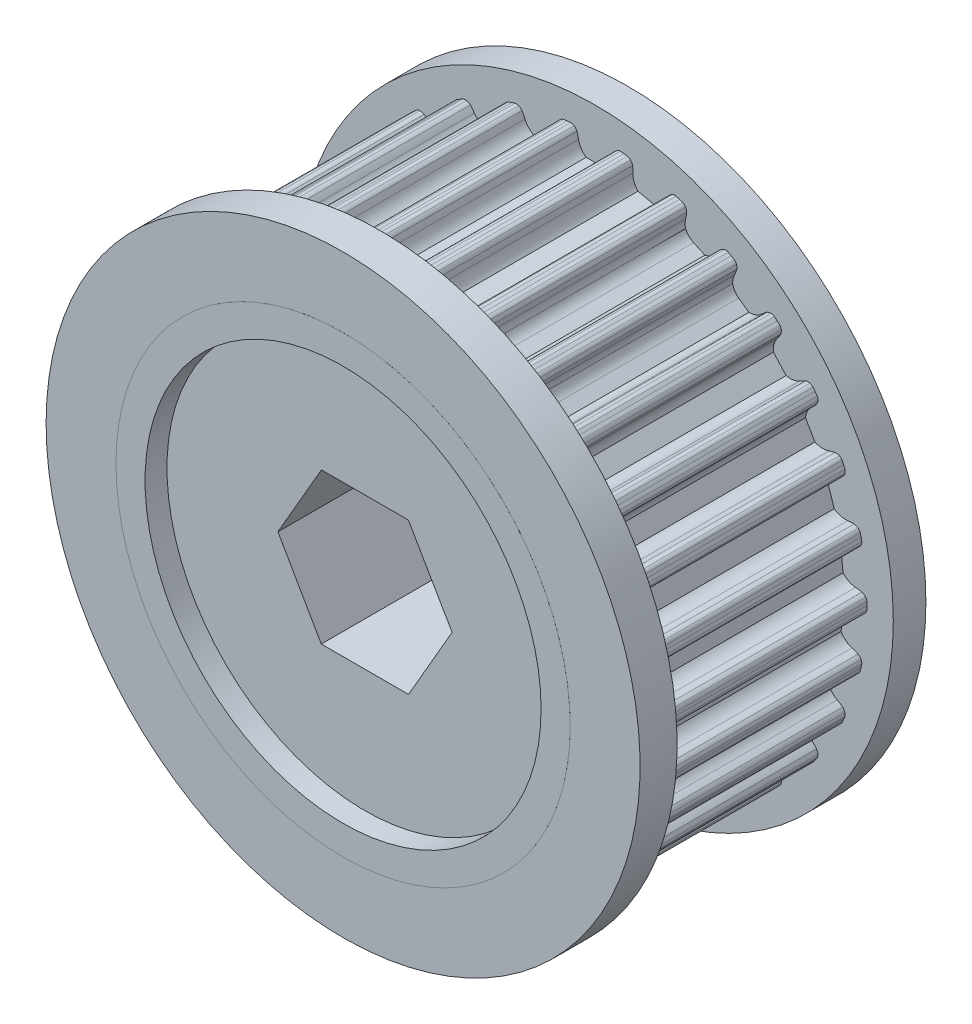
from build123d import *

# Parameters (mm, degrees)
BOSS_EXTRUDE1_DEPTH    = 18.5
CUT_EXTRUDE2_START     = -1.5875
CUT_EXTRUDE2_OUTLINE_R = 19.5
CUT_EXTRUDE2_DEPTH     = 1.5875
HOLE1_D                = 34
HOLE1_DEPTH            = 9.5
SKETCH10_R             = 17.178376729
BOSS_EXTRUDE3_DEPTH    = 9.5
BOSS_EXTRUDE4_START    = 0.00254
SKETCH11_R             = 19.5
BOSS_EXTRUDE4_DEPTH    = 0.00254
HOLE2_D                = 34
HOLE2_DEPTH            = 9.5
SKETCH14_R             = 17.134108578
BOSS_EXTRUDE5_DEPTH    = 7.62
CUT_EXTRUDE1_DEPTH     = 44.659262742
FILLET1_R              = 1.313177717


# Read off the part's stored shape, not the designer's step: Cut-Extrude2
with BuildPart() as part:
    # Sketch1 → Revolve1 (revolve)
    with BuildSketch(Plane(origin=(0, 0, 0), x_dir=(1, 0, 0), z_dir=(0, 1, 0))):
        Polygon((23.331731391, 12.05), (0, 12.05), (0, 9.25), (23.3, 9.25), (25.563462781, 9.25), (25.563462781, 12.05), align=None)
    revolve(axis=Axis((0, 0, -11), (0, 0, 1)))

    # Sketch2 → Boss-Extrude1 (add)
    with BuildSketch(Plane.XY.offset(-9.25)):
        with BuildLine():
            Line((-22.220966527, 5.532138415), (-22.198501446, 5.535521924))
            ThreePointArc((-22.198501446, 5.535521924), (-21.926261017, 5.525385682), (-21.655224303, 5.49787761))
            ThreePointArc((-21.655224303, 5.49787761), (-21.042755416, 5.541395644), (-20.489166215, 5.807009938))
            Line((-20.489166215, 5.807009938), (-19.98935847, 7.345260006))
            ThreePointArc((-19.98935847, 7.345260006), (-20.281097376, 7.885538053), (-20.751015856, 8.280745061))
            ThreePointArc((-20.751015856, 8.280745061), (-20.986458003, 8.417801947), (-21.21266307, 8.569620464))
            Line((-21.21266307, 8.569620464), (-21.228848926, 8.585562424))
            ThreePointArc((-21.228848926, 8.585562424), (-21.338210088, 8.728762181), (-21.418316561, 8.890159169))
            ThreePointArc((-21.418316561, 8.890159169), (-21.437347286, 9.04701588), (-21.410246912, 9.202681439))
            ThreePointArc((-21.410246912, 9.202681439), (-21.351945296, 9.341601113), (-21.288640136, 9.47831326))
            ThreePointArc((-21.288640136, 9.47831326), (-21.229402632, 9.616836444), (-21.16517659, 9.753118394))
            ThreePointArc((-21.16517659, 9.753118394), (-21.067628226, 9.877418486), (-20.938326932, 9.968233528))
            ThreePointArc((-20.938326932, 9.968233528), (-20.764783903, 10.016698481), (-20.585188843, 10.03124664))
            Line((-20.585188843, 10.03124664), (-20.562511207, 10.029885458))
            ThreePointArc((-20.562511207, 10.029885458), (-20.298327328, 9.963368749), (-20.038932665, 9.880110093))
            ThreePointArc((-20.038932665, 9.880110093), (-19.430799785, 9.795337711), (-18.834083519, 9.94005003))
            Line((-18.834083519, 9.94005003), (-18.0253776, 11.34076977))
            ThreePointArc((-18.0253776, 11.34076977), (-18.198411189, 11.929897374), (-18.575892665, 12.414169706))
            ThreePointArc((-18.575892665, 12.414169706), (-18.777694108, 12.597182745), (-18.967391207, 12.792714342))
            Line((-18.967391207, 12.792714342), (-18.979908843, 12.81167316))
            ThreePointArc((-18.979908843, 12.81167316), (-19.057107298, 12.974481124), (-19.101906932, 13.149006272))
            ThreePointArc((-19.101906932, 13.149006272), (-19.087909446, 13.306391998), (-19.02903659, 13.453021406))
            ThreePointArc((-19.02903659, 13.453021406), (-18.94312598, 13.576783764), (-18.852780136, 13.69734654))
            ThreePointArc((-18.852780136, 13.69734654), (-18.766036524, 13.82052649), (-18.674879365, 13.940477008))
            ThreePointArc((-18.674879365, 13.940477008), (-18.553619224, 14.0417794), (-18.408261964, 14.103726664))
            ThreePointArc((-18.408261964, 14.103726664), (-18.228434837, 14.115050917), (-18.049739628, 14.091941251))
            Line((-18.049739628, 14.091941251), (-18.027840558, 14.085894868))
            ThreePointArc((-18.027840558, 14.085894868), (-17.783259331, 13.965904793), (-17.546843513, 13.830534355))
            ThreePointArc((-17.546843513, 13.830534355), (-16.969624964, 13.621176518), (-16.355860998, 13.638662237))
            Line((-16.355860998, 13.638662237), (-15.273601234, 14.840633475))
            ThreePointArc((-15.273601234, 14.840633475), (-15.320367108, 15.452862934), (-15.588913828, 16.005035566))
            ThreePointArc((-15.588913828, 16.005035566), (-15.748254875, 16.22600621), (-15.893153332, 16.456705217))
            Line((-15.893153332, 16.456705217), (-15.901455668, 16.477852302))
            ThreePointArc((-15.901455668, 16.477852302), (-15.943117473, 16.653152982), (-15.950652308, 16.833178705))
            ThreePointArc((-15.950652308, 16.833178705), (-15.904238369, 16.984214934), (-15.816166058, 17.115399783))
            ThreePointArc((-15.816166058, 17.115399783), (-15.706401159, 17.218595817), (-15.592963178, 17.317740049))
            ThreePointArc((-15.592963178, 17.317740049), (-15.482504571, 17.420193211), (-15.368400299, 17.518569883))
            ThreePointArc((-15.368400299, 17.518569883), (-15.228728032, 17.592447174), (-15.073667617, 17.622819268))
            ThreePointArc((-15.073667617, 17.622819268), (-14.895415699, 17.596507897), (-14.725430178, 17.536750409))
            Line((-14.725430178, 17.536750409), (-14.705266769, 17.526283082))
            ThreePointArc((-14.705266769, 17.526283082), (-14.490977569, 17.358063781), (-14.2878731, 17.1764979))
            ThreePointArc((-14.2878731, 17.1764979), (-13.766796103, 16.851704549), (-13.162808867, 16.741199459))
            Line((-13.162808867, 16.741199459), (-11.854295203, 17.691890285))
            ThreePointArc((-11.854295203, 17.691890285), (-11.772749468, 18.300464233), (-11.920624653, 18.896404571))
            ThreePointArc((-11.920624653, 18.896404571), (-12.030541335, 19.145675342), (-12.124308393, 19.401459105))
            Line((-12.124308393, 19.401459105), (-12.128032577, 19.423870229))
            ThreePointArc((-12.128032577, 19.423870229), (-12.13233691, 19.604002145), (-12.102277639, 19.781660454))
            ThreePointArc((-12.102277639, 19.781660454), (-12.025475757, 19.919746179), (-11.912053174, 20.02975306))
            ThreePointArc((-11.912053174, 20.02975306), (-11.78323124, 20.107872608), (-11.651658906, 20.181265218))
            ThreePointArc((-11.651658906, 20.181265218), (-11.522312874, 20.258513897), (-11.390248395, 20.33101719))
            ThreePointArc((-11.390248395, 20.33101719), (-11.238268349, 20.374240588), (-11.080281663, 20.371710106))
            ThreePointArc((-11.080281663, 20.371710106), (-10.911395418, 20.308913044), (-10.75754877, 20.215119424))
            Line((-10.75754877, 20.215119424), (-10.740002259, 20.200688624))
            ThreePointArc((-10.740002259, 20.200688624), (-10.565370552, 19.991592089), (-10.404454072, 19.771766064))
            ThreePointArc((-10.404454072, 19.771766064), (-9.962292192, 19.345732228), (-9.394478826, 19.112065932))
            Line((-9.394478826, 19.112065932), (-7.916899588, 19.769926593))
            ThreePointArc((-7.916899588, 19.769926593), (-7.710606185, 20.348247429), (-7.731346979, 20.96191002))
            ThreePointArc((-7.731346979, 20.96191002), (-7.78703541, 21.228586591), (-7.825572998, 21.498276132))
            Line((-7.825572998, 21.498276132), (-7.824556265, 21.52097182))
            ThreePointArc((-7.824556265, 21.52097182), (-7.791315007, 21.698062343), (-7.724975364, 21.865588718))
            ThreePointArc((-7.724975364, 21.865588718), (-7.621142151, 21.984688929), (-7.487326407, 22.068710016))
            ThreePointArc((-7.487326407, 22.068710016), (-7.345077574, 22.118338878), (-7.201121229, 22.162772257))
            ThreePointArc((-7.201121229, 22.162772257), (-7.058540815, 22.211440314), (-6.914287979, 22.254901488))
            ThreePointArc((-6.914287979, 22.254901488), (-6.756642412, 22.265581922), (-6.602634231, 22.230259458))
            ThreePointArc((-6.602634231, 22.230259458), (-6.450494799, 22.133721238), (-6.319510859, 22.009990717))
            Line((-6.319510859, 22.009990717), (-6.305348114, 21.99222714))
            ThreePointArc((-6.305348114, 21.99222714), (-6.178006143, 21.751391892), (-6.066310474, 21.502913176))
            ThreePointArc((-6.066310474, 21.502913176), (-5.722388308, 20.994258577), (-5.215564981, 20.647643413))
            Line((-5.215564981, 20.647643413), (-3.633497472, 20.983922244))
            ThreePointArc((-3.633497472, 20.983922244), (-3.311472412, 21.506714571), (-3.204172343, 22.111279416))
            ThreePointArc((-3.204172343, 22.111279416), (-3.203198671, 22.383706739), (-3.184822512, 22.655515333))
            Line((-3.184822512, 22.655515333), (-3.179109298, 22.677503675))
            ThreePointArc((-3.179109298, 22.677503675), (-3.109775252, 22.843813099), (-3.010054597, 22.993885833))
            ThreePointArc((-3.010054597, 22.993885833), (-2.883728063, 23.08879528), (-2.735367547, 23.143158446))
            ThreePointArc((-2.735367547, 23.143158446), (-2.585908772, 23.162127603), (-2.43586, 23.175659799))
            ThreePointArc((-2.43586, 23.175659799), (-2.286276652, 23.193620208), (-2.13614, 23.206139799))
            ThreePointArc((-2.13614, 23.206139799), (-1.97971878, 23.183810484), (-1.83642, 23.117239799))
            ThreePointArc((-1.83642, 23.117239799), (-1.707676605, 22.991179605), (-1.60528, 22.842919799))
            Line((-1.60528, 22.842919799), (-1.59512, 22.822599799))
            ThreePointArc((-1.59512, 22.822599799), (-1.52063322, 22.560551495), (-1.46304, 22.294279799))
            ThreePointArc((-1.46304, 22.294279799), (-1.232388596, 21.725235085), (-0.808705919, 21.280819799))
            Line((-0.808705919, 21.280819799), (0.808705919, 21.280819799))
            ThreePointArc((0.808705919, 21.280819799), (1.232388596, 21.725235085), (1.46304, 22.294279799))
            ThreePointArc((1.46304, 22.294279799), (1.52063322, 22.560551495), (1.59512, 22.822599799))
            Line((1.59512, 22.822599799), (1.60528, 22.842919799))
            ThreePointArc((1.60528, 22.842919799), (1.707676605, 22.991179605), (1.83642, 23.117239799))
            ThreePointArc((1.83642, 23.117239799), (1.97971878, 23.183810484), (2.13614, 23.206139799))
            ThreePointArc((2.13614, 23.206139799), (2.286276652, 23.193620208), (2.43586, 23.175659799))
            ThreePointArc((2.43586, 23.175659799), (2.585908772, 23.162127603), (2.735367547, 23.143158446))
            ThreePointArc((2.735367547, 23.143158446), (2.883728063, 23.08879528), (3.010054597, 22.993885833))
            ThreePointArc((3.010054597, 22.993885833), (3.109775252, 22.843813099), (3.179109298, 22.677503675))
            Line((3.179109298, 22.677503675), (3.184822512, 22.655515333))
            ThreePointArc((3.184822512, 22.655515333), (3.203198671, 22.383706739), (3.204172343, 22.111279416))
            ThreePointArc((3.204172343, 22.111279416), (3.311472412, 21.506714571), (3.633497472, 20.983922244))
            Line((3.633497472, 20.983922244), (5.215564981, 20.647643413))
            ThreePointArc((5.215564981, 20.647643413), (5.722388308, 20.994258577), (6.066310474, 21.502913176))
            ThreePointArc((6.066310474, 21.502913176), (6.178006143, 21.751391892), (6.305348114, 21.99222714))
            Line((6.305348114, 21.99222714), (6.319510859, 22.009990717))
            ThreePointArc((6.319510859, 22.009990717), (6.450494799, 22.133721238), (6.602634231, 22.230259458))
            ThreePointArc((6.602634231, 22.230259458), (6.756642412, 22.265581922), (6.914287979, 22.254901488))
            ThreePointArc((6.914287979, 22.254901488), (7.058540815, 22.211440314), (7.201121229, 22.162772257))
            ThreePointArc((7.201121229, 22.162772257), (7.345077574, 22.118338878), (7.487326407, 22.068710016))
            ThreePointArc((7.487326407, 22.068710016), (7.621142151, 21.984688929), (7.724975364, 21.865588718))
            ThreePointArc((7.724975364, 21.865588718), (7.791315007, 21.698062343), (7.824556265, 21.52097182))
            Line((7.824556265, 21.52097182), (7.825572998, 21.498276132))
            ThreePointArc((7.825572998, 21.498276132), (7.78703541, 21.228586591), (7.731346979, 20.96191002))
            ThreePointArc((7.731346979, 20.96191002), (7.691108328, 20.610306232), (7.727198057, 20.258252394))
            Line((7.727198057, 20.258252394), (7.940111861, 19.759591824))
            Line((7.940111861, 19.759591824), (9.394478826, 19.112065932))
            ThreePointArc((9.394478826, 19.112065932), (9.962292192, 19.345732228), (10.404454072, 19.771766064))
            ThreePointArc((10.404454072, 19.771766064), (10.565370552, 19.991592089), (10.740002259, 20.200688624))
            Line((10.740002259, 20.200688624), (10.75754877, 20.215119424))
            ThreePointArc((10.75754877, 20.215119424), (10.911395418, 20.308913044), (11.080281663, 20.371710106))
            ThreePointArc((11.080281663, 20.371710106), (11.238268349, 20.374240588), (11.390248395, 20.33101719))
            ThreePointArc((11.390248395, 20.33101719), (11.522312874, 20.258513897), (11.651658906, 20.181265218))
            ThreePointArc((11.651658906, 20.181265218), (11.78323124, 20.107872608), (11.912053174, 20.02975306))
            ThreePointArc((11.912053174, 20.02975306), (12.025475757, 19.919746179), (12.102277639, 19.781660454))
            ThreePointArc((12.102277639, 19.781660454), (12.13233691, 19.604002145), (12.128032577, 19.423870229))
            Line((12.128032577, 19.423870229), (12.124308393, 19.401459105))
            ThreePointArc((12.124308393, 19.401459105), (12.030541335, 19.145675342), (11.920624653, 18.896404571))
            ThreePointArc((11.920624653, 18.896404571), (11.808162774, 18.560850254), (11.770267748, 18.20898616))
            Line((11.770267748, 18.20898616), (11.874851512, 17.676955252))
            Line((11.874851512, 17.676955252), (13.162808867, 16.741199459))
            ThreePointArc((13.162808867, 16.741199459), (13.766796103, 16.851704549), (14.2878731, 17.1764979))
            ThreePointArc((14.2878731, 17.1764979), (14.490977569, 17.358063781), (14.705266769, 17.526283082))
            Line((14.705266769, 17.526283082), (14.725430178, 17.536750409))
            ThreePointArc((14.725430178, 17.536750409), (14.895415699, 17.596507897), (15.073667617, 17.622819268))
            ThreePointArc((15.073667617, 17.622819268), (15.228728032, 17.592447174), (15.368400299, 17.518569883))
            ThreePointArc((15.368400299, 17.518569883), (15.482504571, 17.420193211), (15.592963178, 17.317740049))
            ThreePointArc((15.592963178, 17.317740049), (15.706401159, 17.218595817), (15.816166058, 17.115399783))
            ThreePointArc((15.816166058, 17.115399783), (15.904238369, 16.984214934), (15.950652308, 16.833178705))
            ThreePointArc((15.950652308, 16.833178705), (15.943117473, 16.653152982), (15.901455668, 16.477852302))
            Line((15.901455668, 16.477852302), (15.893153332, 16.456705217))
            ThreePointArc((15.893153332, 16.456705217), (15.748254875, 16.22600621), (15.588913828, 16.005035566))
            ThreePointArc((15.588913828, 16.005035566), (15.320367108, 15.452862934), (15.273601234, 14.840633475))
            Line((15.273601234, 14.840633475), (16.355860998, 13.638662237))
            ThreePointArc((16.355860998, 13.638662237), (16.969624964, 13.621176518), (17.546843513, 13.830534355))
            ThreePointArc((17.546843513, 13.830534355), (17.783259331, 13.965904793), (18.027840558, 14.085894868))
            Line((18.027840558, 14.085894868), (18.049739628, 14.091941251))
            ThreePointArc((18.049739628, 14.091941251), (18.228434837, 14.115050917), (18.408261964, 14.103726664))
            ThreePointArc((18.408261964, 14.103726664), (18.553619224, 14.0417794), (18.674879365, 13.940477008))
            ThreePointArc((18.674879365, 13.940477008), (18.766036524, 13.82052649), (18.852780136, 13.69734654))
            ThreePointArc((18.852780136, 13.69734654), (18.94312598, 13.576783764), (19.02903659, 13.453021406))
            ThreePointArc((19.02903659, 13.453021406), (19.087909446, 13.306391998), (19.101906932, 13.149006272))
            ThreePointArc((19.101906932, 13.149006272), (19.057107298, 12.974481124), (18.979908843, 12.81167316))
            Line((18.979908843, 12.81167316), (18.967391207, 12.792714342))
            ThreePointArc((18.967391207, 12.792714342), (18.777694108, 12.597182745), (18.575892665, 12.414169706))
            ThreePointArc((18.575892665, 12.414169706), (18.198411189, 11.929897374), (18.0253776, 11.34076977))
            Line((18.0253776, 11.34076977), (18.834083519, 9.94005003))
            ThreePointArc((18.834083519, 9.94005003), (19.430799785, 9.795337711), (20.038932665, 9.880110093))
            ThreePointArc((20.038932665, 9.880110093), (20.298327328, 9.963368749), (20.562511207, 10.029885458))
            Line((20.562511207, 10.029885458), (20.585188843, 10.03124664))
            ThreePointArc((20.585188843, 10.03124664), (20.764783903, 10.016698481), (20.938326932, 9.968233528))
            ThreePointArc((20.938326932, 9.968233528), (21.067628226, 9.877418486), (21.16517659, 9.753118394))
            ThreePointArc((21.16517659, 9.753118394), (21.229402632, 9.616836444), (21.288640136, 9.47831326))
            ThreePointArc((21.288640136, 9.47831326), (21.351945296, 9.341601113), (21.410246912, 9.202681439))
            ThreePointArc((21.410246912, 9.202681439), (21.437347286, 9.04701588), (21.418316561, 8.890159169))
            ThreePointArc((21.418316561, 8.890159169), (21.338210088, 8.728762181), (21.228848926, 8.585562424))
            Line((21.228848926, 8.585562424), (21.21266307, 8.569620464))
            ThreePointArc((21.21266307, 8.569620464), (20.986458003, 8.417801947), (20.751015856, 8.280745061))
            ThreePointArc((20.751015856, 8.280745061), (20.281097376, 7.885538053), (19.98935847, 7.345260006))
            Line((19.98935847, 7.345260006), (20.489166215, 5.807009938))
            ThreePointArc((20.489166215, 5.807009938), (21.042755416, 5.541395644), (21.655224303, 5.49787761))
            ThreePointArc((21.655224303, 5.49787761), (21.926261017, 5.525385682), (22.198501446, 5.535521924))
            Line((22.198501446, 5.535521924), (22.220966527, 5.532138415))
            ThreePointArc((22.220966527, 5.532138415), (22.393612272, 5.480568256), (22.553286539, 5.397080753))
            ThreePointArc((22.553286539, 5.397080753), (22.660880781, 5.281366988), (22.730454037, 5.139501705))
            ThreePointArc((22.730454037, 5.139501705), (22.764941975, 4.992844498), (22.794084408, 4.845032208))
            ThreePointArc((22.794084408, 4.845032208), (22.827582145, 4.698145667), (22.855726706, 4.550140133))
            ThreePointArc((22.855726706, 4.550140133), (22.849870183, 4.392241756), (22.798642981, 4.24276945))
            ThreePointArc((22.798642981, 4.24276945), (22.686730706, 4.101554447), (22.549986443, 3.984221411))
            Line((22.549986443, 3.984221411), (22.530839767, 3.971993051))
            ThreePointArc((22.530839767, 3.971993051), (22.278012979, 3.87052281), (22.019220079, 3.785412121))
            ThreePointArc((22.019220079, 3.785412121), (21.477402288, 3.49654288), (21.079708455, 3.028727134))
            Line((21.079708455, 3.028727134), (21.248774029, 1.420175647))
            ThreePointArc((21.248774029, 1.420175647), (21.735041661, 1.045267995), (22.325078725, 0.875361493))
            ThreePointArc((22.325078725, 0.875361493), (22.595911887, 0.845916746), (22.864310652, 0.799229519))
            Line((22.864310652, 0.799229519), (22.885581346, 0.791249195))
            ThreePointArc((22.885581346, 0.791249195), (23.043732328, 0.704910899), (23.182559302, 0.590049652))
            ThreePointArc((23.182559302, 0.590049652), (23.263744106, 0.454494409), (23.302301569, 0.30126413))
            ThreePointArc((23.302301569, 0.30126413), (23.305544115, 0.150641289), (23.303317813, 0))
            ThreePointArc((23.303317813, 0), (23.305544115, -0.150641289), (23.302301569, -0.30126413))
            ThreePointArc((23.302301569, -0.30126413), (23.263744106, -0.454494409), (23.182559302, -0.590049652))
            ThreePointArc((23.182559302, -0.590049652), (23.043732328, -0.704910899), (22.885581346, -0.791249195))
            Line((22.885581346, -0.791249195), (22.864310652, -0.799229519))
            ThreePointArc((22.864310652, -0.799229519), (22.595911887, -0.845916746), (22.325078725, -0.875361493))
            ThreePointArc((22.325078725, -0.875361493), (21.735041661, -1.045267995), (21.248774029, -1.420175647))
            Line((21.248774029, -1.420175647), (21.079708455, -3.028727134))
            ThreePointArc((21.079708455, -3.028727134), (21.477402288, -3.49654288), (22.019220079, -3.785412121))
            ThreePointArc((22.019220079, -3.785412121), (22.278012979, -3.87052281), (22.530839767, -3.971993051))
            Line((22.530839767, -3.971993051), (22.549986443, -3.984221411))
            ThreePointArc((22.549986443, -3.984221411), (22.686730706, -4.101554447), (22.798642981, -4.24276945))
            ThreePointArc((22.798642981, -4.24276945), (22.849870183, -4.392241756), (22.855726706, -4.550140133))
            ThreePointArc((22.855726706, -4.550140133), (22.827582145, -4.698145667), (22.794084408, -4.845032208))
            ThreePointArc((22.794084408, -4.845032208), (22.764941975, -4.992844498), (22.730454037, -5.139501705))
            ThreePointArc((22.730454037, -5.139501705), (22.660880781, -5.281366988), (22.553286539, -5.397080753))
            ThreePointArc((22.553286539, -5.397080753), (22.393612272, -5.480568256), (22.220966527, -5.532138415))
            Line((22.220966527, -5.532138415), (22.198501446, -5.535521924))
            ThreePointArc((22.198501446, -5.535521924), (21.926261017, -5.525385682), (21.655224303, -5.49787761))
            ThreePointArc((21.655224303, -5.49787761), (21.042755416, -5.541395644), (20.489166215, -5.807009938))
            Line((20.489166215, -5.807009938), (19.98935847, -7.345260006))
            ThreePointArc((19.98935847, -7.345260006), (20.281097376, -7.885538053), (20.751015856, -8.280745061))
            ThreePointArc((20.751015856, -8.280745061), (20.986458003, -8.417801947), (21.21266307, -8.569620464))
            Line((21.21266307, -8.569620464), (21.228848926, -8.585562424))
            ThreePointArc((21.228848926, -8.585562424), (21.338210088, -8.728762181), (21.418316561, -8.890159169))
            ThreePointArc((21.418316561, -8.890159169), (21.437347286, -9.04701588), (21.410246912, -9.202681439))
            ThreePointArc((21.410246912, -9.202681439), (21.351945296, -9.341601113), (21.288640136, -9.47831326))
            ThreePointArc((21.288640136, -9.47831326), (21.229402632, -9.616836444), (21.16517659, -9.753118394))
            ThreePointArc((21.16517659, -9.753118394), (21.067628226, -9.877418486), (20.938326932, -9.968233528))
            ThreePointArc((20.938326932, -9.968233528), (20.764783903, -10.016698481), (20.585188843, -10.03124664))
            Line((20.585188843, -10.03124664), (20.562511207, -10.029885458))
            ThreePointArc((20.562511207, -10.029885458), (20.298327328, -9.963368749), (20.038932665, -9.880110093))
            ThreePointArc((20.038932665, -9.880110093), (19.430799785, -9.795337711), (18.834083519, -9.94005003))
            Line((18.834083519, -9.94005003), (18.0253776, -11.34076977))
            ThreePointArc((18.0253776, -11.34076977), (18.198411189, -11.929897374), (18.575892665, -12.414169706))
            ThreePointArc((18.575892665, -12.414169706), (18.777694108, -12.597182745), (18.967391207, -12.792714342))
            Line((18.967391207, -12.792714342), (18.979908843, -12.81167316))
            ThreePointArc((18.979908843, -12.81167316), (19.057107298, -12.974481124), (19.101906932, -13.149006272))
            ThreePointArc((19.101906932, -13.149006272), (19.087909446, -13.306391998), (19.02903659, -13.453021406))
            ThreePointArc((19.02903659, -13.453021406), (18.94312598, -13.576783764), (18.852780136, -13.69734654))
            ThreePointArc((18.852780136, -13.69734654), (18.766036524, -13.82052649), (18.674879365, -13.940477008))
            ThreePointArc((18.674879365, -13.940477008), (18.553619224, -14.0417794), (18.408261964, -14.103726664))
            ThreePointArc((18.408261964, -14.103726664), (18.228434837, -14.115050917), (18.049739628, -14.091941251))
            Line((18.049739628, -14.091941251), (18.027840558, -14.085894868))
            ThreePointArc((18.027840558, -14.085894868), (17.783259331, -13.965904793), (17.546843513, -13.830534355))
            ThreePointArc((17.546843513, -13.830534355), (16.969624964, -13.621176518), (16.355860998, -13.638662237))
            Line((16.355860998, -13.638662237), (15.273601234, -14.840633475))
            ThreePointArc((15.273601234, -14.840633475), (15.320367108, -15.452862934), (15.588913828, -16.005035566))
            ThreePointArc((15.588913828, -16.005035566), (15.748254875, -16.22600621), (15.893153332, -16.456705217))
            Line((15.893153332, -16.456705217), (15.901455668, -16.477852302))
            ThreePointArc((15.901455668, -16.477852302), (15.943117473, -16.653152982), (15.950652308, -16.833178705))
            ThreePointArc((15.950652308, -16.833178705), (15.904238369, -16.984214934), (15.816166058, -17.115399783))
            ThreePointArc((15.816166058, -17.115399783), (15.706401159, -17.218595817), (15.592963178, -17.317740049))
            ThreePointArc((15.592963178, -17.317740049), (15.482504571, -17.420193211), (15.368400299, -17.518569883))
            ThreePointArc((15.368400299, -17.518569883), (15.228728032, -17.592447174), (15.073667617, -17.622819268))
            ThreePointArc((15.073667617, -17.622819268), (14.895415699, -17.596507897), (14.725430178, -17.536750409))
            Line((14.725430178, -17.536750409), (14.705266769, -17.526283082))
            ThreePointArc((14.705266769, -17.526283082), (14.490977569, -17.358063781), (14.2878731, -17.1764979))
            ThreePointArc((14.2878731, -17.1764979), (13.766796103, -16.851704549), (13.162808867, -16.741199459))
            Line((13.162808867, -16.741199459), (11.874851512, -17.676955252))
            Line((11.874851512, -17.676955252), (11.770267748, -18.20898616))
            ThreePointArc((11.770267748, -18.20898616), (11.808162774, -18.560850254), (11.920624653, -18.896404571))
            ThreePointArc((11.920624653, -18.896404571), (12.030541335, -19.145675342), (12.124308393, -19.401459105))
            Line((12.124308393, -19.401459105), (12.128032577, -19.423870229))
            ThreePointArc((12.128032577, -19.423870229), (12.13233691, -19.604002145), (12.102277639, -19.781660454))
            ThreePointArc((12.102277639, -19.781660454), (12.025475757, -19.919746179), (11.912053174, -20.02975306))
            ThreePointArc((11.912053174, -20.02975306), (11.78323124, -20.107872608), (11.651658906, -20.181265218))
            ThreePointArc((11.651658906, -20.181265218), (11.522312874, -20.258513897), (11.390248395, -20.33101719))
            ThreePointArc((11.390248395, -20.33101719), (11.238268349, -20.374240588), (11.080281663, -20.371710106))
            ThreePointArc((11.080281663, -20.371710106), (10.911395418, -20.308913044), (10.75754877, -20.215119424))
            Line((10.75754877, -20.215119424), (10.740002259, -20.200688624))
            ThreePointArc((10.740002259, -20.200688624), (10.565370552, -19.991592089), (10.404454072, -19.771766064))
            ThreePointArc((10.404454072, -19.771766064), (9.962292192, -19.345732228), (9.394478826, -19.112065932))
            Line((9.394478826, -19.112065932), (7.940111861, -19.759591824))
            Line((7.940111861, -19.759591824), (7.727198057, -20.258252394))
            ThreePointArc((7.727198057, -20.258252394), (7.691108328, -20.610306232), (7.731346979, -20.96191002))
            ThreePointArc((7.731346979, -20.96191002), (7.78703541, -21.228586591), (7.825572998, -21.498276132))
            Line((7.825572998, -21.498276132), (7.824556265, -21.52097182))
            ThreePointArc((7.824556265, -21.52097182), (7.791315007, -21.698062343), (7.724975364, -21.865588718))
            ThreePointArc((7.724975364, -21.865588718), (7.621142151, -21.984688929), (7.487326407, -22.068710016))
            ThreePointArc((7.487326407, -22.068710016), (7.345077574, -22.118338878), (7.201121229, -22.162772257))
            ThreePointArc((7.201121229, -22.162772257), (7.058540815, -22.211440314), (6.914287979, -22.254901488))
            ThreePointArc((6.914287979, -22.254901488), (6.756642412, -22.265581922), (6.602634231, -22.230259458))
            ThreePointArc((6.602634231, -22.230259458), (6.450494799, -22.133721238), (6.319510859, -22.009990717))
            Line((6.319510859, -22.009990717), (6.305348114, -21.99222714))
            ThreePointArc((6.305348114, -21.99222714), (6.178006143, -21.751391892), (6.066310474, -21.502913176))
            ThreePointArc((6.066310474, -21.502913176), (5.722388308, -20.994258577), (5.215564981, -20.647643413))
            Line((5.215564981, -20.647643413), (3.633497472, -20.983922244))
            ThreePointArc((3.633497472, -20.983922244), (3.311472412, -21.506714571), (3.204172343, -22.111279416))
            ThreePointArc((3.204172343, -22.111279416), (3.203198671, -22.383706739), (3.184822512, -22.655515333))
            Line((3.184822512, -22.655515333), (3.179109298, -22.677503675))
            ThreePointArc((3.179109298, -22.677503675), (3.109775252, -22.843813099), (3.010054597, -22.993885833))
            ThreePointArc((3.010054597, -22.993885833), (2.883728063, -23.08879528), (2.735367547, -23.143158446))
            ThreePointArc((2.735367547, -23.143158446), (2.585908772, -23.162127603), (2.43586, -23.175659799))
            ThreePointArc((2.43586, -23.175659799), (2.286276652, -23.193620208), (2.13614, -23.206139799))
            ThreePointArc((2.13614, -23.206139799), (1.97971878, -23.183810484), (1.83642, -23.117239799))
            ThreePointArc((1.83642, -23.117239799), (1.707676605, -22.991179605), (1.60528, -22.842919799))
            Line((1.60528, -22.842919799), (1.59512, -22.822599799))
            ThreePointArc((1.59512, -22.822599799), (1.52063322, -22.560551495), (1.46304, -22.294279799))
            ThreePointArc((1.46304, -22.294279799), (1.232388596, -21.725235085), (0.808705919, -21.280819799))
            Line((0.808705919, -21.280819799), (-0.808705919, -21.280819799))
            ThreePointArc((-0.808705919, -21.280819799), (-1.232388596, -21.725235085), (-1.46304, -22.294279799))
            ThreePointArc((-1.46304, -22.294279799), (-1.52063322, -22.560551495), (-1.59512, -22.822599799))
            Line((-1.59512, -22.822599799), (-1.60528, -22.842919799))
            ThreePointArc((-1.60528, -22.842919799), (-1.707676605, -22.991179605), (-1.83642, -23.117239799))
            ThreePointArc((-1.83642, -23.117239799), (-1.97971878, -23.183810484), (-2.13614, -23.206139799))
            ThreePointArc((-2.13614, -23.206139799), (-2.286276652, -23.193620208), (-2.43586, -23.175659799))
            ThreePointArc((-2.43586, -23.175659799), (-2.585908772, -23.162127603), (-2.735367547, -23.143158446))
            ThreePointArc((-2.735367547, -23.143158446), (-2.883728063, -23.08879528), (-3.010054597, -22.993885833))
            ThreePointArc((-3.010054597, -22.993885833), (-3.109775252, -22.843813099), (-3.179109298, -22.677503675))
            Line((-3.179109298, -22.677503675), (-3.184822512, -22.655515333))
            ThreePointArc((-3.184822512, -22.655515333), (-3.203198671, -22.383706739), (-3.204172343, -22.111279416))
            ThreePointArc((-3.204172343, -22.111279416), (-3.311472412, -21.506714571), (-3.633497472, -20.983922244))
            Line((-3.633497472, -20.983922244), (-5.215564981, -20.647643413))
            ThreePointArc((-5.215564981, -20.647643413), (-5.722388308, -20.994258577), (-6.066310474, -21.502913176))
            ThreePointArc((-6.066310474, -21.502913176), (-6.178006143, -21.751391892), (-6.305348114, -21.99222714))
            Line((-6.305348114, -21.99222714), (-6.319510859, -22.009990717))
            ThreePointArc((-6.319510859, -22.009990717), (-6.450494799, -22.133721238), (-6.602634231, -22.230259458))
            ThreePointArc((-6.602634231, -22.230259458), (-6.756642412, -22.265581922), (-6.914287979, -22.254901488))
            ThreePointArc((-6.914287979, -22.254901488), (-7.058540815, -22.211440314), (-7.201121229, -22.162772257))
            ThreePointArc((-7.201121229, -22.162772257), (-7.345077574, -22.118338878), (-7.487326407, -22.068710016))
            ThreePointArc((-7.487326407, -22.068710016), (-7.621142151, -21.984688929), (-7.724975364, -21.865588718))
            ThreePointArc((-7.724975364, -21.865588718), (-7.791315007, -21.698062343), (-7.824556265, -21.52097182))
            Line((-7.824556265, -21.52097182), (-7.825572998, -21.498276132))
            ThreePointArc((-7.825572998, -21.498276132), (-7.78703541, -21.228586591), (-7.731346979, -20.96191002))
            ThreePointArc((-7.731346979, -20.96191002), (-7.710606185, -20.348247429), (-7.916899588, -19.769926593))
            Line((-7.916899588, -19.769926593), (-9.394478826, -19.112065932))
            ThreePointArc((-9.394478826, -19.112065932), (-9.962292192, -19.345732228), (-10.404454072, -19.771766064))
            ThreePointArc((-10.404454072, -19.771766064), (-10.565370552, -19.991592089), (-10.740002259, -20.200688624))
            Line((-10.740002259, -20.200688624), (-10.75754877, -20.215119424))
            ThreePointArc((-10.75754877, -20.215119424), (-10.911395418, -20.308913044), (-11.080281663, -20.371710106))
            ThreePointArc((-11.080281663, -20.371710106), (-11.238268349, -20.374240588), (-11.390248395, -20.33101719))
            ThreePointArc((-11.390248395, -20.33101719), (-11.522312874, -20.258513897), (-11.651658906, -20.181265218))
            ThreePointArc((-11.651658906, -20.181265218), (-11.78323124, -20.107872608), (-11.912053174, -20.02975306))
            ThreePointArc((-11.912053174, -20.02975306), (-12.025475757, -19.919746179), (-12.102277639, -19.781660454))
            ThreePointArc((-12.102277639, -19.781660454), (-12.13233691, -19.604002145), (-12.128032577, -19.423870229))
            Line((-12.128032577, -19.423870229), (-12.124308393, -19.401459105))
            ThreePointArc((-12.124308393, -19.401459105), (-12.030541335, -19.145675342), (-11.920624653, -18.896404571))
            ThreePointArc((-11.920624653, -18.896404571), (-11.772749468, -18.300464233), (-11.854295203, -17.691890285))
            Line((-11.854295203, -17.691890285), (-13.162808867, -16.741199459))
            ThreePointArc((-13.162808867, -16.741199459), (-13.766796103, -16.851704549), (-14.2878731, -17.1764979))
            ThreePointArc((-14.2878731, -17.1764979), (-14.490977569, -17.358063781), (-14.705266769, -17.526283082))
            Line((-14.705266769, -17.526283082), (-14.725430178, -17.536750409))
            ThreePointArc((-14.725430178, -17.536750409), (-14.895415699, -17.596507897), (-15.073667617, -17.622819268))
            ThreePointArc((-15.073667617, -17.622819268), (-15.228728032, -17.592447174), (-15.368400299, -17.518569883))
            ThreePointArc((-15.368400299, -17.518569883), (-15.482504571, -17.420193211), (-15.592963178, -17.317740049))
            ThreePointArc((-15.592963178, -17.317740049), (-15.706401159, -17.218595817), (-15.816166058, -17.115399783))
            ThreePointArc((-15.816166058, -17.115399783), (-15.904238369, -16.984214934), (-15.950652308, -16.833178705))
            ThreePointArc((-15.950652308, -16.833178705), (-15.943117473, -16.653152982), (-15.901455668, -16.477852302))
            Line((-15.901455668, -16.477852302), (-15.893153332, -16.456705217))
            ThreePointArc((-15.893153332, -16.456705217), (-15.748254875, -16.22600621), (-15.588913828, -16.005035566))
            ThreePointArc((-15.588913828, -16.005035566), (-15.320367108, -15.452862934), (-15.273601234, -14.840633475))
            Line((-15.273601234, -14.840633475), (-16.355860998, -13.638662237))
            ThreePointArc((-16.355860998, -13.638662237), (-16.969624964, -13.621176518), (-17.546843513, -13.830534355))
            ThreePointArc((-17.546843513, -13.830534355), (-17.783259331, -13.965904793), (-18.027840558, -14.085894868))
            Line((-18.027840558, -14.085894868), (-18.049739628, -14.091941251))
            ThreePointArc((-18.049739628, -14.091941251), (-18.228434837, -14.115050917), (-18.408261964, -14.103726664))
            ThreePointArc((-18.408261964, -14.103726664), (-18.553619224, -14.0417794), (-18.674879365, -13.940477008))
            ThreePointArc((-18.674879365, -13.940477008), (-18.766036524, -13.82052649), (-18.852780136, -13.69734654))
            ThreePointArc((-18.852780136, -13.69734654), (-18.94312598, -13.576783764), (-19.02903659, -13.453021406))
            ThreePointArc((-19.02903659, -13.453021406), (-19.087909446, -13.306391998), (-19.101906932, -13.149006272))
            ThreePointArc((-19.101906932, -13.149006272), (-19.057107298, -12.974481124), (-18.979908843, -12.81167316))
            Line((-18.979908843, -12.81167316), (-18.967391207, -12.792714342))
            ThreePointArc((-18.967391207, -12.792714342), (-18.777694108, -12.597182745), (-18.575892665, -12.414169706))
            ThreePointArc((-18.575892665, -12.414169706), (-18.198411189, -11.929897374), (-18.0253776, -11.34076977))
            Line((-18.0253776, -11.34076977), (-18.834083519, -9.94005003))
            ThreePointArc((-18.834083519, -9.94005003), (-19.430799785, -9.795337711), (-20.038932665, -9.880110093))
            ThreePointArc((-20.038932665, -9.880110093), (-20.298327328, -9.963368749), (-20.562511207, -10.029885458))
            Line((-20.562511207, -10.029885458), (-20.585188843, -10.03124664))
            ThreePointArc((-20.585188843, -10.03124664), (-20.764783903, -10.016698481), (-20.938326932, -9.968233528))
            ThreePointArc((-20.938326932, -9.968233528), (-21.067628226, -9.877418486), (-21.16517659, -9.753118394))
            ThreePointArc((-21.16517659, -9.753118394), (-21.229402632, -9.616836444), (-21.288640136, -9.47831326))
            ThreePointArc((-21.288640136, -9.47831326), (-21.351945296, -9.341601113), (-21.410246912, -9.202681439))
            ThreePointArc((-21.410246912, -9.202681439), (-21.437347286, -9.04701588), (-21.418316561, -8.890159169))
            ThreePointArc((-21.418316561, -8.890159169), (-21.338210088, -8.728762181), (-21.228848926, -8.585562424))
            Line((-21.228848926, -8.585562424), (-21.21266307, -8.569620464))
            ThreePointArc((-21.21266307, -8.569620464), (-20.986458003, -8.417801947), (-20.751015856, -8.280745061))
            ThreePointArc((-20.751015856, -8.280745061), (-20.281097376, -7.885538053), (-19.98935847, -7.345260006))
            Line((-19.98935847, -7.345260006), (-20.489166215, -5.807009938))
            ThreePointArc((-20.489166215, -5.807009938), (-21.042755416, -5.541395644), (-21.655224303, -5.49787761))
            ThreePointArc((-21.655224303, -5.49787761), (-21.926261017, -5.525385682), (-22.198501446, -5.535521924))
            Line((-22.198501446, -5.535521924), (-22.220966527, -5.532138415))
            ThreePointArc((-22.220966527, -5.532138415), (-22.393612272, -5.480568256), (-22.553286539, -5.397080753))
            ThreePointArc((-22.553286539, -5.397080753), (-22.660880781, -5.281366988), (-22.730454037, -5.139501705))
            ThreePointArc((-22.730454037, -5.139501705), (-22.764941975, -4.992844498), (-22.794084408, -4.845032208))
            ThreePointArc((-22.794084408, -4.845032208), (-22.827582145, -4.698145667), (-22.855726706, -4.550140133))
            ThreePointArc((-22.855726706, -4.550140133), (-22.849870183, -4.392241756), (-22.798642981, -4.24276945))
            ThreePointArc((-22.798642981, -4.24276945), (-22.686730706, -4.101554447), (-22.549986443, -3.984221411))
            Line((-22.549986443, -3.984221411), (-22.530839767, -3.971993051))
            ThreePointArc((-22.530839767, -3.971993051), (-22.278012979, -3.87052281), (-22.019220079, -3.785412121))
            ThreePointArc((-22.019220079, -3.785412121), (-21.477402288, -3.49654288), (-21.079708455, -3.028727134))
            Line((-21.079708455, -3.028727134), (-21.248774029, -1.420175647))
            ThreePointArc((-21.248774029, -1.420175647), (-21.735041661, -1.045267995), (-22.325078725, -0.875361493))
            ThreePointArc((-22.325078725, -0.875361493), (-22.595911887, -0.845916746), (-22.864310652, -0.799229519))
            Line((-22.864310652, -0.799229519), (-22.885581346, -0.791249195))
            ThreePointArc((-22.885581346, -0.791249195), (-23.043732328, -0.704910899), (-23.182559302, -0.590049652))
            ThreePointArc((-23.182559302, -0.590049652), (-23.263744106, -0.454494409), (-23.302301569, -0.30126413))
            ThreePointArc((-23.302301569, -0.30126413), (-23.305544115, -0.150641289), (-23.303317813, 0))
            ThreePointArc((-23.303317813, 0), (-23.305544115, 0.150641289), (-23.302301569, 0.30126413))
            ThreePointArc((-23.302301569, 0.30126413), (-23.263744106, 0.454494409), (-23.182559302, 0.590049652))
            ThreePointArc((-23.182559302, 0.590049652), (-23.043732328, 0.704910899), (-22.885581346, 0.791249195))
            Line((-22.885581346, 0.791249195), (-22.864310652, 0.799229519))
            ThreePointArc((-22.864310652, 0.799229519), (-22.595911887, 0.845916746), (-22.325078725, 0.875361493))
            ThreePointArc((-22.325078725, 0.875361493), (-21.735041661, 1.045267995), (-21.248774029, 1.420175647))
            Line((-21.248774029, 1.420175647), (-21.079708455, 3.028727134))
            ThreePointArc((-21.079708455, 3.028727134), (-21.477402288, 3.49654288), (-22.019220079, 3.785412121))
            ThreePointArc((-22.019220079, 3.785412121), (-22.278012979, 3.87052281), (-22.530839767, 3.971993051))
            Line((-22.530839767, 3.971993051), (-22.549986443, 3.984221411))
            ThreePointArc((-22.549986443, 3.984221411), (-22.686730706, 4.101554447), (-22.798642981, 4.24276945))
            ThreePointArc((-22.798642981, 4.24276945), (-22.849870183, 4.392241756), (-22.855726706, 4.550140133))
            ThreePointArc((-22.855726706, 4.550140133), (-22.827582145, 4.698145667), (-22.794084408, 4.845032208))
            ThreePointArc((-22.794084408, 4.845032208), (-22.764941975, 4.992844498), (-22.730454037, 5.139501705))
            ThreePointArc((-22.730454037, 5.139501705), (-22.660880781, 5.281366988), (-22.553286539, 5.397080753))
            ThreePointArc((-22.553286539, 5.397080753), (-22.393612272, 5.480568256), (-22.220966527, 5.532138415))
        make_face()
    extrude(amount=BOSS_EXTRUDE1_DEPTH)

    # Sketch6 → Revolve2 (revolve)
    with BuildSketch(Plane(origin=(0, 0, 0), x_dir=(-1, 0, 0), z_dir=(0, -1, 0)), mode=Mode.PRIVATE) as revolve2_sk:
        Polygon((-10.88284734, -12.425), (0, -12.425), (0, -9.25), (-23.3, -9.25), (-25.5, -9.25), (-25.5, -12.425), align=None)
    revolve(revolve2_sk.sketch.rotate(Axis((0, 0, 11), (0, 0, -1)), 180), axis=Axis((0, 0, 11), (0, 0, -1)))

    # Cut-Extrude2 outline → Cut-Extrude2 (cut)
    with BuildSketch(Plane(origin=(0, 0, -12.05), x_dir=(-1, 0, 0), z_dir=(0, 0, -1)).offset(CUT_EXTRUDE2_START)):
        Circle(CUT_EXTRUDE2_OUTLINE_R)
    extrude(amount=CUT_EXTRUDE2_DEPTH, mode=Mode.SUBTRACT)

    # Hole1
    with Locations(Plane(origin=(0, 0, -10.4625), x_dir=(-1, 0, 0), z_dir=(0, 0, -1))):
        with Locations((0, 0)):
            Hole(HOLE1_D / 2, depth=HOLE1_DEPTH)

    # Sketch10 → Boss-Extrude3 (add)
    with BuildSketch(Plane(origin=(0, 0, -0.9625), x_dir=(-1, 0, 0), z_dir=(0, 0, -1))):
        Circle(SKETCH10_R)
    extrude(amount=BOSS_EXTRUDE3_DEPTH)

    # Sketch11 → Boss-Extrude4 (add)
    with BuildSketch(Plane.XY.offset(12.425).offset(BOSS_EXTRUDE4_START)):
        with Locations(Location((0, 0, 0), (0, 0, 180))):
            Circle(SKETCH11_R)
    extrude(amount=-BOSS_EXTRUDE4_DEPTH)

    # Hole2
    with Locations(Plane.XY.offset(12.42754)):
        with Locations((0, 0)):
            Hole(HOLE2_D / 2, depth=HOLE2_DEPTH)

    # Sketch14 → Boss-Extrude5 (add)
    with BuildSketch(Plane.XY.offset(2.92754)):
        Circle(SKETCH14_R)
    extrude(amount=BOSS_EXTRUDE5_DEPTH)

    # Sketch15 → Cut-Extrude1 (cut, through all)
    with BuildSketch(Plane.XY.offset(12.42754)):
        Polygon((-3.741916975, 6.477), (-7.472624874, 0.006838918), (-3.749837635, -6.477), (3.74023517, -6.477), (7.481290528, 0.005255489), (3.731127468, 6.482255489), align=None)
    extrude(amount=-CUT_EXTRUDE1_DEPTH, mode=Mode.SUBTRACT)

    # Fillet1
    fillet1_edges = [part.edges().sort_by_distance(p)[0] for p in [
        (7.940111861, -19.759591824, 0),
        (11.874851512, -17.676955252, 0),
        (11.874851512, 17.676955252, 0),
        (7.940111861, 19.759591824, 0),
    ]]
    fillet(fillet1_edges, radius=FILLET1_R)


solid = part.part
